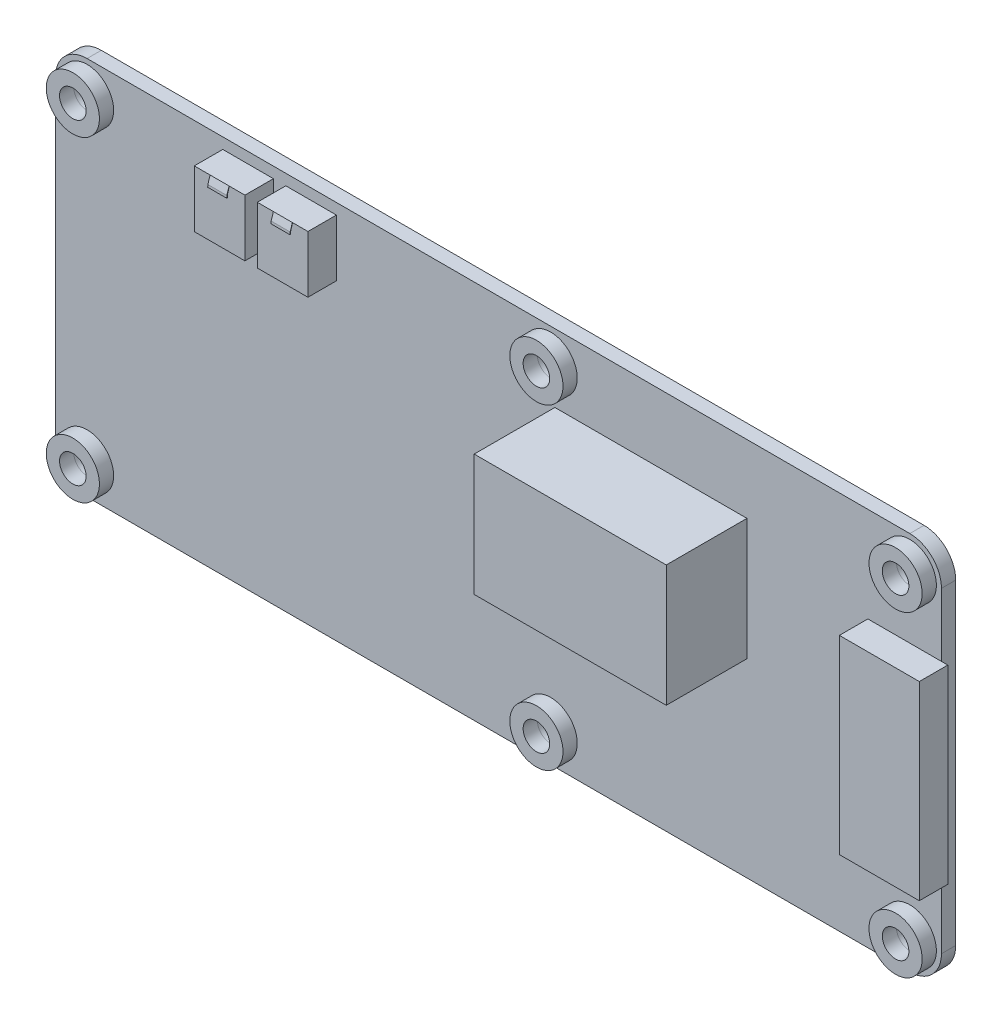
from build123d import *

# Parameters (mm, degrees)
BOSS_EXTRUDE1_DEPTH   = 2.25
SKETCH2_R             = 4.2
SKETCH2_R_2           = 2.1
BOSS_EXTRUDE2_DEPTH   = 2.25
BOSS_EXTRUDE2_2_DEPTH = 2.25
BOSS_EXTRUDE2_3_DEPTH = 2.25
BOSS_EXTRUDE2_4_DEPTH = 2.25
BOSS_EXTRUDE2_5_DEPTH = 2.25
BOSS_EXTRUDE2_6_DEPTH = 2.25
SKETCH4_R             = 2.1
CUT_EXTRUDE2_DEPTH    = 2.25
SKETCH5_W             = 8
SKETCH5_H             = 9
BOSS_EXTRUDE3_DEPTH   = 4.5
LOFT1_START           = -41.058294719
LOFT1_DEPTH           = 3
LPATTERN1_COUNT       = 2
LPATTERN1_PITCH       = 10
SKETCH7_W             = 30.346967849
SKETCH7_H             = 19.209264207
BOSS_EXTRUDE4_DEPTH   = 12.75
SKETCH8_W             = 12.629936129
SKETCH8_H             = 30
BOSS_EXTRUDE5_DEPTH   = 4.5


# Read off the part's stored shape, not the designer's step: Loft1
with BuildPart() as part:
    # Sketch1 → Boss-Extrude1 (new body)
    with BuildSketch(Plane.XY):
        with BuildLine():
            Line((-65, -30), (65, -30))
            ThreePointArc((65, -30), (68.535533906, -28.535533906), (70, -25))
            Line((70, -25), (70, 25))
            ThreePointArc((70, 25), (68.535533906, 28.535533906), (65, 30))
            Line((65, 30), (-65, 30))
            ThreePointArc((-65, 30), (-68.535533906, 28.535533906), (-70, 25))
            Line((-70, 25), (-70, -25))
            ThreePointArc((-70, -25), (-68.535533906, -28.535533906), (-65, -30))
        make_face()
    extrude(amount=BOSS_EXTRUDE1_DEPTH)

    # Sketch4 → Cut-Extrude2 (cut)
    with BuildSketch(Plane.XY.offset(2.25)):
        with Locations((-65, 25)):
            Circle(SKETCH4_R)
        with Locations((65, 25)):
            Circle(SKETCH4_R)
        with Locations((65, -25)):
            Circle(SKETCH4_R)
        with Locations((-65, -25)):
            Circle(SKETCH4_R)
        with Locations((8.25, 25)):
            Circle(SKETCH4_R)
        with Locations((8.25, -25)):
            Circle(SKETCH4_R)
    extrude(amount=-CUT_EXTRUDE2_DEPTH, mode=Mode.SUBTRACT)

    # Sketch5 → Boss-Extrude3 (add)
    with BuildSketch(Plane.XY.offset(2.25)):
        with Locations((-39.558294718, 23.781458124)):
            Rectangle(SKETCH5_W, SKETCH5_H)
        with Locations((-29.601987553, 23.781458124)):
            Rectangle(SKETCH5_W, SKETCH5_H)
    extrude(amount=BOSS_EXTRUDE3_DEPTH)

    # Loft1 outline → Loft1 (add)
    with BuildSketch(Plane.YZ.offset(LOFT1_START)):
        Polygon((27.16929948, 7.10787959), (26.797003838, 7.132337071), (26.797003838, 7.032337071), (27.144841998, 7.032337071), (28.181458123, 6.75), (28.281458123, 6.75), align=None)
    loft1 = extrude(amount=LOFT1_DEPTH)

    # LPattern1: Loft1 ×2
    with Locations(*[(i * LPATTERN1_PITCH, 0, 0) for i in range(1, LPATTERN1_COUNT)]):
        add(loft1)

    # Sketch7 → Boss-Extrude4 (add)
    with BuildSketch(Plane.XY.offset(2.25)):
        with Locations((24.092085971, 9.604632104)):
            Rectangle(SKETCH7_W, SKETCH7_H)
    extrude(amount=BOSS_EXTRUDE4_DEPTH)

    # Sketch8 → Boss-Extrude5 (add)
    with BuildSketch(Plane.XY.offset(2.25)):
        with Locations((64.685031936, 0)):
            Rectangle(SKETCH8_W, SKETCH8_H)
    extrude(amount=BOSS_EXTRUDE5_DEPTH)


with BuildPart() as body_2:
    # Sketch2 → Boss-Extrude2 (new body)
    with BuildSketch(Plane.XY.offset(2.25)):
        with Locations((-65, 25)):
            Circle(SKETCH2_R)
        with Locations((-65, 25)):
            Circle(SKETCH2_R_2, mode=Mode.SUBTRACT)
    extrude(amount=BOSS_EXTRUDE2_DEPTH)


with BuildPart() as body_3:
    # Sketch2 → Boss-Extrude2 2 (new body)
    with BuildSketch(Plane.XY.offset(2.25)):
        with Locations((65, 25)):
            Circle(SKETCH2_R)
        with Locations((65, 25)):
            Circle(SKETCH2_R_2, mode=Mode.SUBTRACT)
    extrude(amount=BOSS_EXTRUDE2_2_DEPTH)


with BuildPart() as body_4:
    # Sketch2 → Boss-Extrude2 3 (new body)
    with BuildSketch(Plane.XY.offset(2.25)):
        with Locations((65, -25)):
            Circle(SKETCH2_R)
        with Locations((65, -25)):
            Circle(SKETCH2_R_2, mode=Mode.SUBTRACT)
    extrude(amount=BOSS_EXTRUDE2_3_DEPTH)


with BuildPart() as body_5:
    # Sketch2 → Boss-Extrude2 4 (new body)
    with BuildSketch(Plane.XY.offset(2.25)):
        with Locations((-65, -25)):
            Circle(SKETCH2_R)
        with Locations((-65, -25)):
            Circle(SKETCH2_R_2, mode=Mode.SUBTRACT)
    extrude(amount=BOSS_EXTRUDE2_4_DEPTH)


with BuildPart() as body_6:
    # Sketch2 → Boss-Extrude2 5 (new body)
    with BuildSketch(Plane.XY.offset(2.25)):
        with Locations((8.25, 25)):
            Circle(SKETCH2_R)
        with Locations((8.25, 25)):
            Circle(SKETCH2_R_2, mode=Mode.SUBTRACT)
    extrude(amount=BOSS_EXTRUDE2_5_DEPTH)


with BuildPart() as body_7:
    # Sketch2 → Boss-Extrude2 6 (new body)
    with BuildSketch(Plane.XY.offset(2.25)):
        with Locations((8.25, -25)):
            Circle(SKETCH2_R)
        with Locations((8.25, -25)):
            Circle(SKETCH2_R_2, mode=Mode.SUBTRACT)
    extrude(amount=BOSS_EXTRUDE2_6_DEPTH)


solid = Compound([part.part, body_2.part, body_3.part, body_4.part, body_5.part, body_6.part, body_7.part])
